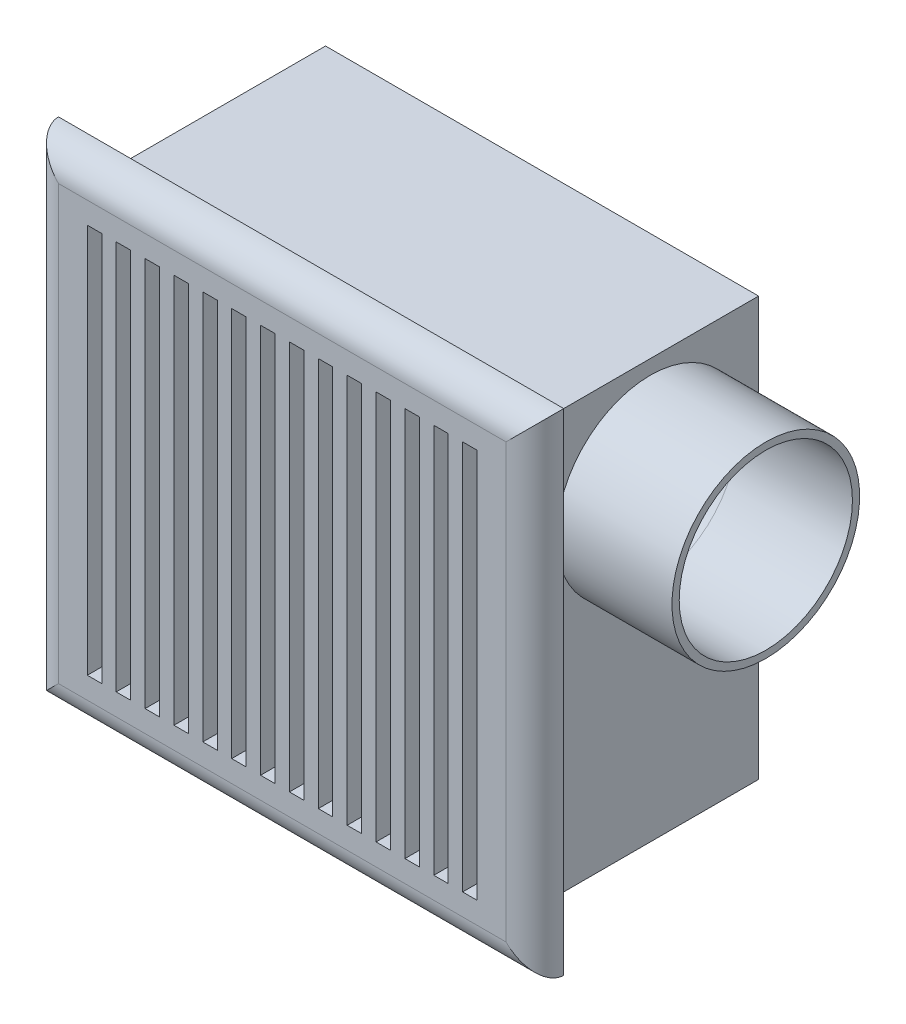
from build123d import *

# Parameters (mm, degrees)
SKETCH2_W          = 190.5
SKETCH2_H          = 184.15
HOUSING_DEPTH      = 101.6
SKETCH4_W          = 177.8
SKETCH4_H          = 171.45
CUT_EXTRUDE1_DEPTH = 95.25
SKETCH6_W          = 222.25
SKETCH6_H          = 215.9
GRILL_DEPTH        = 12.7
CUT_EXTRUDE2_REACH = 311.298
SKETCH7_W          = 6.35
SKETCH7_H          = 171.45
CUT_EXTRUDE3_REACH = 311.298
SKETCH8_W          = 6.35
SKETCH8_H          = 171.45
LPATTERN2_COUNT    = 13
LPATTERN2_PITCH    = 12.7
FILLET1_R          = 12.7
SKETCH9_R          = 41.275
DUCT_DEPTH         = 50.8
SKETCH10_R         = 38.1
CUT_EXTRUDE4_DEPTH = 57.15


# Read off the part's stored shape, not the designer's step: Split1, Split4
with BuildPart() as part:
    # Sketch2 → Housing (new body)
    with BuildSketch(Plane.XY):
        with Locations((-95.25, 92.075)):
            Rectangle(SKETCH2_W, SKETCH2_H)
    extrude(amount=HOUSING_DEPTH)

    # Sketch4 → Cut-Extrude1 (cut)
    with BuildSketch(Plane.XY.offset(101.6)):
        with Locations((-95.25, 92.075)):
            Rectangle(SKETCH4_W, SKETCH4_H)
    extrude(amount=-CUT_EXTRUDE1_DEPTH, mode=Mode.SUBTRACT)

    # Sketch6 → Grill (add)
    with BuildSketch(Plane.XY.offset(101.6)):
        with Locations((-95.25, 92.075)):
            Rectangle(SKETCH6_W, SKETCH6_H)
    extrude(amount=GRILL_DEPTH)

    # Sketch7 → Cut-Extrude2 (cut, up to next)
    with BuildSketch(Plane.XY.offset(114.3), mode=Mode.PRIVATE) as cut_extrude2_sk1:
        with Locations((-177.8, 92.075)):
            Rectangle(SKETCH7_W, SKETCH7_H)
    cut_extrude2_tool1 = extrude(cut_extrude2_sk1.sketch, amount=-CUT_EXTRUDE2_REACH, mode=Mode.PRIVATE) & part.part
    add(cut_extrude2_tool1.solids().sort_by_distance((-177.8, 92.075, 114.3))[0], mode=Mode.SUBTRACT)

    # Sketch8 → Cut-Extrude3 (cut, up to next)
    with BuildSketch(Plane.XY.offset(114.3), mode=Mode.PRIVATE) as cut_extrude3_sk1:
        with Locations((-165.1, 92.075)):
            Rectangle(SKETCH8_W, SKETCH8_H)
    cut_extrude3_tool1 = extrude(cut_extrude3_sk1.sketch, amount=-CUT_EXTRUDE3_REACH, mode=Mode.PRIVATE) & part.part
    cut_extrude3 = cut_extrude3_tool1.solids().sort_by_distance((-165.1, 92.075, 114.3))[0]
    add(cut_extrude3, mode=Mode.SUBTRACT)

    # LPattern2: Cut-Extrude3 ×13
    with Locations(*[(i * LPATTERN2_PITCH, 0, 0) for i in range(1, LPATTERN2_COUNT)]):
        add(cut_extrude3, mode=Mode.SUBTRACT)

    # Fillet1
    fillet1_edges = [part.edges().sort_by_distance(p)[0] for p in [
        (-206.375, 92.075, 114.3),
        (-95.25, -15.875, 114.3),
        (15.875, 92.075, 114.3),
        (-95.25, 200.025, 114.3),
    ]]
    fillet(fillet1_edges, radius=FILLET1_R - 0.0001)  # a hair under: the kernel refuses the full size


with BuildPart() as body_2:
    # Split1: the piece on the far side of the plane
    add(part.part)
    split(bisect_by=Plane.XY.offset(101.6), keep=Keep.BOTTOM)

    # Sketch9 → Duct (add)
    with BuildSketch(Plane(origin=(0, 0, 0), x_dir=(0, 0, -1), z_dir=(1, 0, 0))):
        with Locations(Location((-47.625, 136.525, 0), (0, 0, 270))):
            Circle(SKETCH9_R)
    extrude(amount=DUCT_DEPTH)

    # Sketch10 → Cut-Extrude4 (cut)
    with BuildSketch(Plane(origin=(50.8, 0, 0), x_dir=(0, 0, -1), z_dir=(1, 0, 0))):
        with Locations(Location((-47.625, 136.525, 0), (0, 0, 90))):
            Circle(SKETCH10_R)
    extrude(amount=-CUT_EXTRUDE4_DEPTH, mode=Mode.SUBTRACT)


with BuildPart() as part_1:
    add(part.part)

    # Split1
    split(bisect_by=Plane.XY.offset(101.6), keep=Keep.TOP)


with BuildPart() as body_3:
    # Split4: the piece on the far side of the plane
    add(body_2.part)
    split(bisect_by=Plane.YZ, keep=Keep.BOTTOM)


with BuildPart() as body_2_1:
    add(body_2.part)

    # Split4
    split(bisect_by=Plane.YZ, keep=Keep.TOP)


solid = Compound([part_1.part, body_3.part, body_2_1.part])
